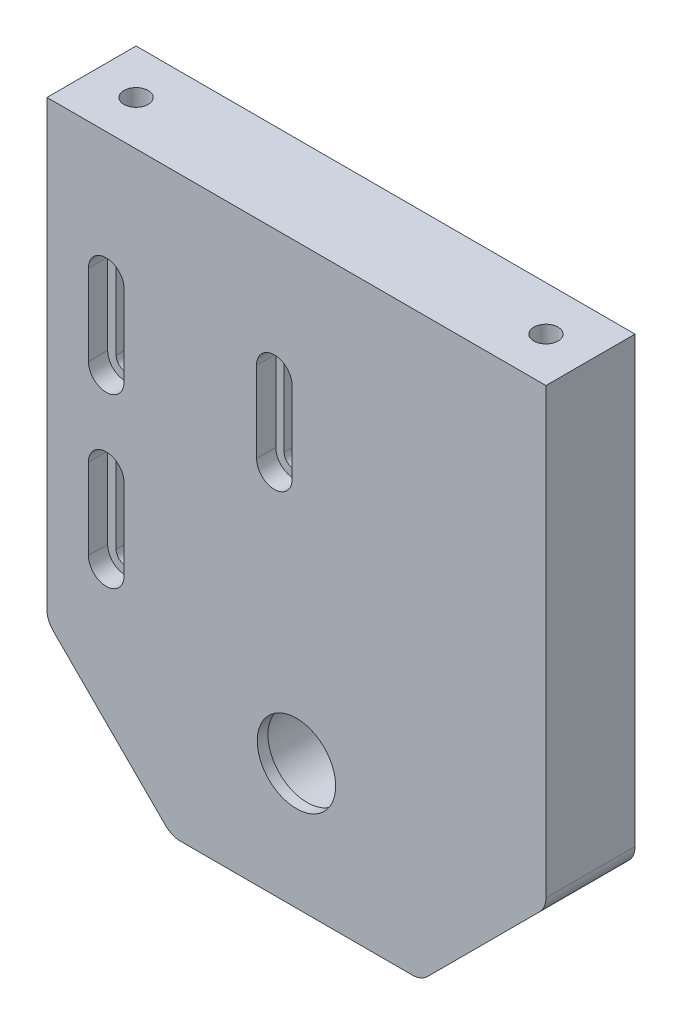
from build123d import *

# Parameters (mm, degrees)
ESQUISSE1_W                                   = 140
ESQUISSE1_H                                   = 162
BOSS_EXTRU_1_DEPTH                            = 25
TROU_POUR_TARAUDAGE_POUR_TROU_TARAUD_M8_D     = 6.8
TROU_POUR_TARAUDAGE_POUR_TROU_TARAUD_M8_DEPTH = 30
TROU_POUR_TARAUDAGE_POUR_TROU_TARAUD_M8_TIP   = 2.042926105
CHANFREIN1_SIZE                               = 35
CONG_3_R                                      = 6
ESQUISSE15_R                                  = 12
ENL_V_MAT_EXTRU_4_DEPTH                       = 22
ESQUISSE16_R                                  = 11
ENL_V_MAT_EXTRU_5_DEPTH                       = 110.293183685
TROU_POUR_TARAUDAGE_POUR_TROU_TARAUD_M4_D     = 3.3
TROU_POUR_TARAUDAGE_POUR_TROU_TARAUD_M4_DEPTH = 15
TROU_POUR_TARAUDAGE_POUR_TROU_TARAUD_M4_TIP   = 0.991420021
ESQUISSE41_R                                  = 25.5
ENL_V_MAT_EXTRU_15_DEPTH                      = 5
TROU_POUR_TARAUDAGE_POUR_TROU_TARAUD_M6_D     = 5
TROU_POUR_TARAUDAGE_POUR_TROU_TARAUD_M6_DEPTH = 12
TROU_POUR_TARAUDAGE_POUR_TROU_TARAUD_M6_TIP   = 1.502151548
RAINURE_DE_CHAMBRAGE_POUR_VIS_T_TE_HEX_DEPTH  = 25
RAINURE_START                                 = 19.6
RAINURE_DE_CHAMBRAGE_POUR_VIS_T_TE_3_DEPTH    = 5.4


# Read off the part's stored shape, not the designer's step: Rainure de chambrage pour vis à tête hexagonale M52
with BuildPart() as part:
    # Esquisse1 → Boss.-Extru.1 (new body)
    with BuildSketch(Plane.XY):
        Rectangle(ESQUISSE1_W, ESQUISSE1_H)
    extrude(amount=BOSS_EXTRU_1_DEPTH)

    # Trou pour taraudage pour trou taraudé M81
    with Locations(Plane(origin=(0, 81, 0), x_dir=(1, 0, 0), z_dir=(0, 1, 0))):
        with Locations((-57.5, -12.5), (57.5, -12.5)):
            Hole(TROU_POUR_TARAUDAGE_POUR_TROU_TARAUD_M8_D / 2, depth=TROU_POUR_TARAUDAGE_POUR_TROU_TARAUD_M8_DEPTH)
            with Locations((0, 0, -(TROU_POUR_TARAUDAGE_POUR_TROU_TARAUD_M8_DEPTH + TROU_POUR_TARAUDAGE_POUR_TROU_TARAUD_M8_TIP / 2))):  # 118° drill point
                Cone(0, TROU_POUR_TARAUDAGE_POUR_TROU_TARAUD_M8_D / 2, TROU_POUR_TARAUDAGE_POUR_TROU_TARAUD_M8_TIP, mode=Mode.SUBTRACT)

    # Chanfrein1
    chanfrein1_edges = [part.edges().sort_by_distance(p)[0] for p in [
        (70, -81, 12.5),
        (-70, -81, 12.5),
    ]]
    chamfer(chanfrein1_edges, length=CHANFREIN1_SIZE)

    # Congé3
    cong_3_edges = [part.edges().sort_by_distance(p)[0] for p in [
        (35, -81, 12.5),
        (-35, -81, 12.5),
        (-70, -46, 12.5),
        (70, -46, 12.5),
    ]]
    fillet(cong_3_edges, radius=CONG_3_R)

    # Esquisse15 → Enlèv. mat.-Extru.4 (cut)
    with BuildSketch(Plane(origin=(0, 0, 0), x_dir=(-1, 0, 0), z_dir=(0, 0, -1))):
        with Locations((0, -45.83)):
            Circle(ESQUISSE15_R)
    extrude(amount=-ENL_V_MAT_EXTRU_4_DEPTH, mode=Mode.SUBTRACT)

    # Esquisse16 → Enlèv. mat.-Extru.5 (cut, through all)
    with BuildSketch(Plane(origin=(0, 0, 22), x_dir=(-1, 0, 0), z_dir=(0, 0, -1))):
        with Locations((0, -45.83)):
            Circle(ESQUISSE16_R)
    extrude(amount=-ENL_V_MAT_EXTRU_5_DEPTH, mode=Mode.SUBTRACT)

    # Trou pour taraudage pour trou taraudé M41
    with Locations(Plane(origin=(0, 0, 0), x_dir=(-1, 0, 0), z_dir=(0, 0, -1))):
        with Locations((-65, -35.83), (-51, -35.83)):
            Hole(TROU_POUR_TARAUDAGE_POUR_TROU_TARAUD_M4_D / 2, depth=TROU_POUR_TARAUDAGE_POUR_TROU_TARAUD_M4_DEPTH)
            with Locations((0, 0, -(TROU_POUR_TARAUDAGE_POUR_TROU_TARAUD_M4_DEPTH + TROU_POUR_TARAUDAGE_POUR_TROU_TARAUD_M4_TIP / 2))):  # 118° drill point
                Cone(0, TROU_POUR_TARAUDAGE_POUR_TROU_TARAUD_M4_D / 2, TROU_POUR_TARAUDAGE_POUR_TROU_TARAUD_M4_TIP, mode=Mode.SUBTRACT)

    # Esquisse41 → Enlèv. mat.-Extru.15 (cut)
    with BuildSketch(Plane(origin=(0, 0, 0), x_dir=(-1, 0, 0), z_dir=(0, 0, -1))):
        with Locations((0, -45.83)):
            Circle(ESQUISSE41_R)
    extrude(amount=-ENL_V_MAT_EXTRU_15_DEPTH, mode=Mode.SUBTRACT)

    # Trou pour taraudage pour trou taraudé M61
    with Locations(Plane(origin=(0, 0, 5), x_dir=(-1, 0, 0), z_dir=(0, 0, -1))):
        with Locations((12.727922061, -33.102077939), (-12.727922061, -58.557922061), (-12.727922061, -33.102077939), (12.727922061, -58.557922061)):
            Hole(TROU_POUR_TARAUDAGE_POUR_TROU_TARAUD_M6_D / 2, depth=TROU_POUR_TARAUDAGE_POUR_TROU_TARAUD_M6_DEPTH)
            with Locations((0, 0, -(TROU_POUR_TARAUDAGE_POUR_TROU_TARAUD_M6_DEPTH + TROU_POUR_TARAUDAGE_POUR_TROU_TARAUD_M6_TIP / 2))):  # 118° drill point
                Cone(0, TROU_POUR_TARAUDAGE_POUR_TROU_TARAUD_M6_D / 2, TROU_POUR_TARAUDAGE_POUR_TROU_TARAUD_M6_TIP, mode=Mode.SUBTRACT)

    # Rainure de chambrage pour vis _ t_te 2 → Rainure de chambrage pour vis à tête hexagonale M52 (cut)
    with BuildSketch(Plane.XY):
        with BuildLine():
            Line((-50.72, -24.484553863), (-50.72, -1.784553863))
            ThreePointArc((-50.72, -1.784553863), (-53.37, 0.865446137), (-56.02, -1.784553863))
            Line((-56.02, -1.784553863), (-56.02, -24.484553863))
            ThreePointArc((-56.02, -24.484553863), (-53.37, -27.134553863), (-50.72, -24.484553863))
        make_face()
        with BuildLine():
            Line((-50.72, 22.655446137), (-50.72, 45.355446137))
            ThreePointArc((-50.72, 45.355446137), (-53.37, 48.005446137), (-56.02, 45.355446137))
            Line((-56.02, 45.355446137), (-56.02, 22.655446137))
            ThreePointArc((-56.02, 22.655446137), (-53.37, 20.005446137), (-50.72, 22.655446137))
        make_face()
        with BuildLine():
            Line((-8.85, 45.355446137), (-8.85, 22.655446137))
            ThreePointArc((-8.85, 22.655446137), (-6.2, 20.005446137), (-3.55, 22.655446137))
            Line((-3.55, 22.655446137), (-3.55, 45.355446137))
            ThreePointArc((-3.55, 45.355446137), (-6.2, 48.005446137), (-8.85, 45.355446137))
        make_face()
    extrude(amount=RAINURE_DE_CHAMBRAGE_POUR_VIS_T_TE_HEX_DEPTH, mode=Mode.SUBTRACT)

    # Rainure de chambrage pour vis _ t_te 3 o → Rainure de chambrage pour vis _ t_te 3 (cut)
    # profile 1 of 3: a face of its own
    with BuildSketch(Plane.XY.offset(RAINURE_START)):
        with BuildLine():
            Line((-58.37, -1.784553863), (-58.37, -24.484553863))
            ThreePointArc((-58.37, -24.484553863), (-53.37, -29.484553863), (-48.37, -24.484553863))
            Line((-48.37, -24.484553863), (-48.37, -1.784553863))
            ThreePointArc((-48.37, -1.784553863), (-53.37, 3.215446137), (-58.37, -1.784553863))
        make_face()
        with BuildLine():
            ThreePointArc((-56.02, -1.784553863), (-53.37, 0.865446137), (-50.72, -1.784553863))
            Line((-50.72, -1.784553863), (-50.72, -24.484553863))
            ThreePointArc((-50.72, -24.484553863), (-53.37, -27.134553863), (-56.02, -24.484553863))
            Line((-56.02, -24.484553863), (-56.02, -1.784553863))
        make_face(mode=Mode.SUBTRACT)
    # profile 2 of 3: a face of its own
    with BuildSketch(Plane.XY.offset(RAINURE_START)):
        with BuildLine():
            Line((-48.37, 22.655446137), (-48.37, 45.355446137))
            ThreePointArc((-48.37, 45.355446137), (-53.37, 50.355446137), (-58.37, 45.355446137))
            Line((-58.37, 45.355446137), (-58.37, 22.655446137))
            ThreePointArc((-58.37, 22.655446137), (-53.37, 17.655446137), (-48.37, 22.655446137))
        make_face()
        with BuildLine():
            ThreePointArc((-56.02, 45.355446137), (-53.37, 48.005446137), (-50.72, 45.355446137))
            Line((-50.72, 45.355446137), (-50.72, 22.655446137))
            ThreePointArc((-50.72, 22.655446137), (-53.37, 20.005446137), (-56.02, 22.655446137))
            Line((-56.02, 22.655446137), (-56.02, 45.355446137))
        make_face(mode=Mode.SUBTRACT)
    # profile 3 of 3: a face of its own
    with BuildSketch(Plane.XY.offset(RAINURE_START)):
        with BuildLine():
            Line((-11.2, 45.355446137), (-11.2, 22.655446137))
            ThreePointArc((-11.2, 22.655446137), (-6.2, 17.655446137), (-1.2, 22.655446137))
            Line((-1.2, 22.655446137), (-1.2, 45.355446137))
            ThreePointArc((-1.2, 45.355446137), (-6.2, 50.355446137), (-11.2, 45.355446137))
        make_face()
        with BuildLine():
            ThreePointArc((-3.55, 22.655446137), (-6.2, 20.005446137), (-8.85, 22.655446137))
            Line((-8.85, 22.655446137), (-8.85, 45.355446137))
            ThreePointArc((-8.85, 45.355446137), (-6.2, 48.005446137), (-3.55, 45.355446137))
            Line((-3.55, 45.355446137), (-3.55, 22.655446137))
        make_face(mode=Mode.SUBTRACT)
    extrude(amount=RAINURE_DE_CHAMBRAGE_POUR_VIS_T_TE_3_DEPTH, mode=Mode.SUBTRACT)


solid = part.part
